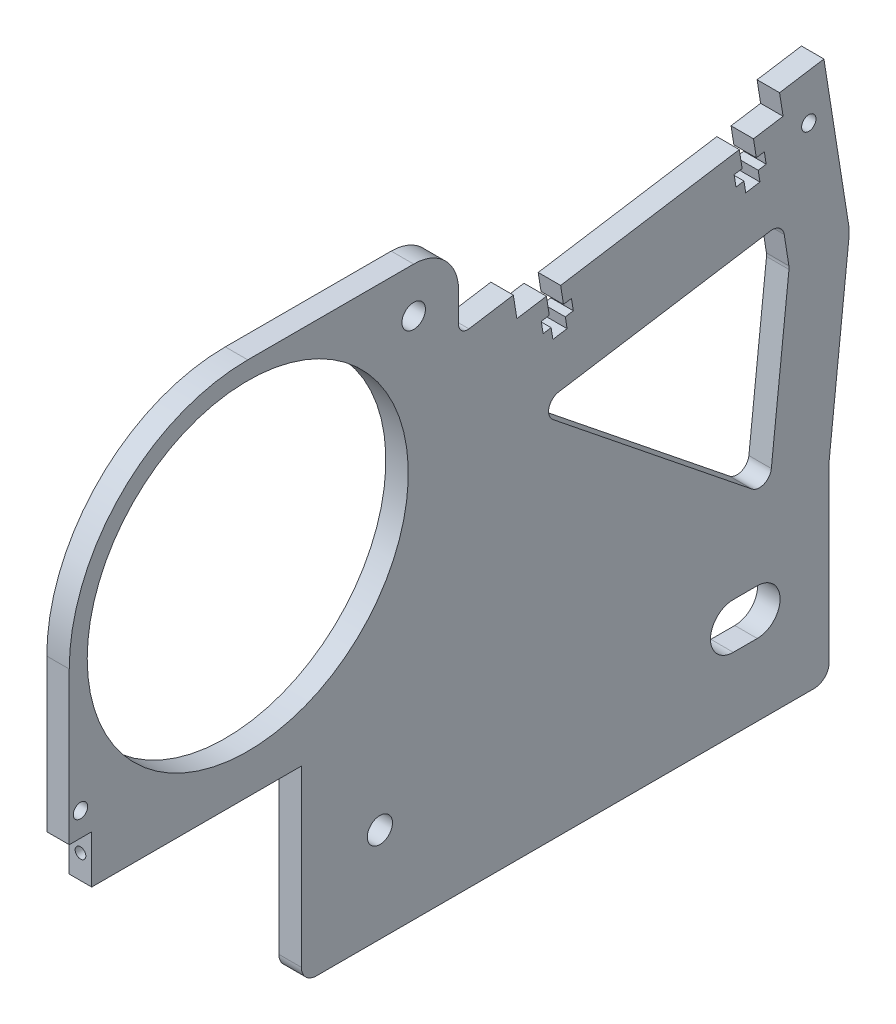
from build123d import *

# Parameters (mm, degrees)
SKETCH1_R           = 1.524
SKETCH1_R_2         = 2.667
SKETCH1_R_3         = 34.04
SKETCH1_R_4         = 2.4892
BOSS_EXTRUDE1_DEPTH = 4.7625
SKETCH2_R           = 1.1303
CUT_EXTRUDE1_DEPTH  = 6.35


with BuildPart() as part:
    # Sketch1 → Boss-Extrude1 (new body)
    with BuildSketch(Plane(origin=(0, 0, 0), x_dir=(0, 0, -1), z_dir=(1, 0, 0))):
        with BuildLine():
            Line((-28.170295117, 0), (77.382795117, 0))
            ThreePointArc((77.382795117, 0), (79.627859148, 0.92993597), (80.557795117, 3.175))
            Line((80.557795117, 3.175), (80.557795117, 40.132))
            Line((80.557795117, 40.132), (84.771740045, 79.196103092))
            ThreePointArc((84.771740045, 79.196103092), (84.816236398, 80.272287311), (84.718413682, 81.344939685))
            Line((84.718413682, 81.344939685), (79.457064092, 114.563793628))
            Line((79.457064092, 114.563793628), (70.049332648, 113.073755348))
            Line((70.049332648, 113.073755348), (70.794351787, 108.369889626))
            Line((70.794351787, 108.369889626), (64.522530825, 107.376530773))
            Line((64.522530825, 107.376530773), (65.123512931, 103.582079091))
            Line((65.123512931, 103.582079091), (66.816904591, 103.850285981))
            Line((66.816904591, 103.850285981), (67.209281338, 101.372916701))
            Line((67.209281338, 101.372916701), (65.515889678, 101.10470981))
            Line((65.515889678, 101.10470981), (65.888399247, 98.752776949))
            Line((65.888399247, 98.752776949), (62.877925185, 98.2759647))
            Line((62.877925185, 98.2759647), (62.505415615, 100.627897561))
            Line((62.505415615, 100.627897561), (60.812023956, 100.359690671))
            Line((60.812023956, 100.359690671), (60.419647209, 102.837059951))
            Line((60.419647209, 102.837059951), (62.113038869, 103.105266841))
            Line((62.113038869, 103.105266841), (61.512056762, 106.899718524))
            Line((61.512056762, 106.899718524), (23.630258147, 100.899831052))
            Line((23.630258147, 100.899831052), (24.231240253, 97.105379369))
            Line((24.231240253, 97.105379369), (25.924631913, 97.373586259))
            Line((25.924631913, 97.373586259), (26.31700866, 94.896216979))
            Line((26.31700866, 94.896216979), (24.623617, 94.628010089))
            Line((24.623617, 94.628010089), (24.99612657, 92.276077228))
            Line((24.99612657, 92.276077228), (21.985652508, 91.799264978))
            Line((21.985652508, 91.799264978), (21.613142938, 94.151197839))
            Line((21.613142938, 94.151197839), (19.919751278, 93.882990949))
            Line((19.919751278, 93.882990949), (19.527374531, 96.360360229))
            Line((19.527374531, 96.360360229), (21.220766191, 96.62856712))
            Line((21.220766191, 96.62856712), (20.619784085, 100.423018802))
            Line((20.619784085, 100.423018802), (14.347963122, 99.429659949))
            Line((14.347963122, 99.429659949), (13.602943983, 104.133525671))
            Line((13.602943983, 104.133525671), (4.195212538, 102.643487392))
            ThreePointArc((4.195212538, 102.643487392), (2.66000635, 103.076460316), (1.992204883, 104.52503368))
            Line((1.992204883, 104.52503368), (1.992204883, 110.875))
            ThreePointArc((1.992204883, 110.875), (-0.797603027, 117.610192091), (-7.532795117, 120.4))
            Line((-7.532795117, 120.4), (-42.707795117, 120.4))
            ThreePointArc((-42.707795117, 120.4), (-69.471786785, 109.313991668), (-80.557795117, 82.55))
            Line((-80.557795117, 82.55), (-80.557795117, 50.292))
            Line((-80.557795117, 50.292), (-75.795295117, 50.292))
            Line((-75.795295117, 50.292), (-75.795295117, 40.132))
            Line((-75.795295117, 40.132), (-31.345295117, 40.132))
            Line((-31.345295117, 40.132), (-31.345295117, 3.175))
            ThreePointArc((-31.345295117, 3.175), (-30.415359148, 0.92993597), (-28.170295117, 0))
        make_face()
        with Locations((-78.176545117, 55.372)):
            Circle(SKETCH1_R, mode=Mode.SUBTRACT)
        with Locations((76.243236649, 104.411043044)):
            Circle(SKETCH1_R, mode=Mode.SUBTRACT)
        with Locations((-14.692204883, 20.066)):
            Circle(SKETCH1_R_2, mode=Mode.SUBTRACT)
        with Locations((-42.707795117, 82.55)):
            Circle(SKETCH1_R_3, mode=Mode.SUBTRACT)
        with Locations((-7.532795117, 110.875)):
            Circle(SKETCH1_R_4, mode=Mode.SUBTRACT)
        with BuildLine():
            Line((65.317795117, 15.2273), (60.237795117, 15.2273))
            ThreePointArc((60.237795117, 15.2273), (55.399095117, 20.066), (60.237795117, 24.9047))
            Line((60.237795117, 24.9047), (65.317795117, 24.9047))
            ThreePointArc((65.317795117, 24.9047), (70.156495117, 20.066), (65.317795117, 15.2273))
        make_face(mode=Mode.SUBTRACT)
        with BuildLine():
            Line((68.302723543, 44.939584088), (72.043814352, 79.620235963))
            ThreePointArc((72.043814352, 79.620235963), (72.057683184, 79.9556661), (72.027193342, 80.289995416))
            Line((72.027193342, 80.289995416), (71.035861406, 86.549018926))
            ThreePointArc((71.035861406, 86.549018926), (70.020107562, 88.206578551), (68.12978948, 88.66040377))
            Line((68.12978948, 88.66040377), (23.218859921, 81.547211328))
            ThreePointArc((23.218859921, 81.547211328), (21.161269703, 79.690326664), (22.026684653, 77.057314107))
            Line((22.026684653, 77.057314107), (64.187855338, 43.230831164))
            ThreePointArc((64.187855338, 43.230831164), (66.751491112, 42.866217372), (68.302723543, 44.939584088))
        make_face(mode=Mode.SUBTRACT)
    extrude(amount=BOSS_EXTRUDE1_DEPTH)

    # Sketch2 → Cut-Extrude1 (cut)
    with BuildSketch(Plane.XY.offset(75.795295117)):
        with Locations((2.38125, 45.212)):
            Circle(SKETCH2_R)
    extrude(amount=-CUT_EXTRUDE1_DEPTH, mode=Mode.SUBTRACT)


solid = part.part
